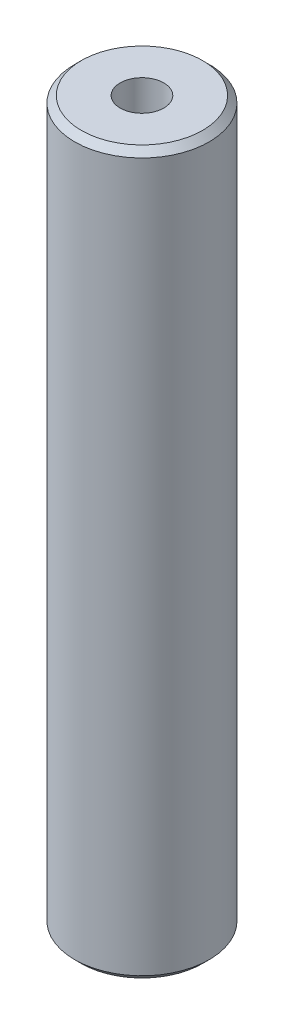
from build123d import *

# Parameters (mm, degrees)
SKETCH1_R           = 45
BOSS_EXTRUDE1_DEPTH = 483.02678312
SKETCH2_R           = 14.612274635
CUT_EXTRUDE1_DEPTH  = 488.201060355
CHAMFER1_SIZE       = 4.429543249


with BuildPart() as part:
    # Sketch1 → Boss-Extrude1 (new body)
    with BuildSketch(Plane(origin=(0, 0, 0), x_dir=(1, 0, 0), z_dir=(0, 1, 0))):
        Circle(SKETCH1_R)
    extrude(amount=BOSS_EXTRUDE1_DEPTH)

    # Sketch2 → Cut-Extrude1 (cut, through all)
    with BuildSketch(Plane(origin=(0, 0, 0), x_dir=(1, 0, 0), z_dir=(0, 1, 0))):
        Circle(SKETCH2_R)
    extrude(amount=CUT_EXTRUDE1_DEPTH, mode=Mode.SUBTRACT)

    # Chamfer1
    chamfer1_edges = [part.edges().sort_by_distance(p)[0] for p in [
        (-45, 483.02678312, 0),
        (-45, 0, 0),
    ]]
    chamfer(chamfer1_edges, length=CHAMFER1_SIZE)


solid = part.part
